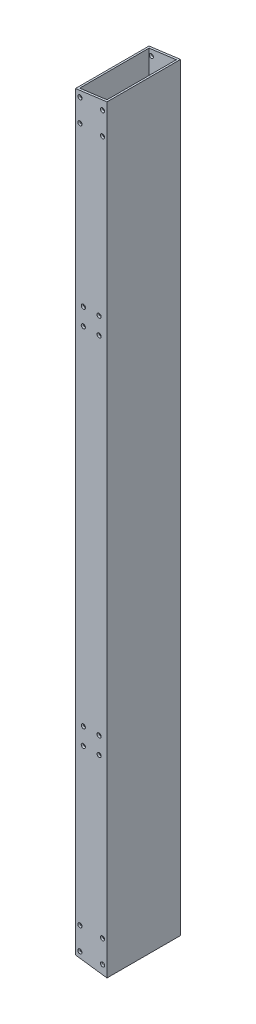
from build123d import *

# Parameters (mm, degrees)
SKETCH_1_W          = 30
SKETCH_1_H          = 750
SKETCH_1_R          = 2
EXTRUDE_2_DEPTH     = 70
SKETCH_2_W          = 26
SKETCH_2_H          = 66
CUT_EXTRUDE_3_DEPTH = 754.408919512
CUT_EXTRUDE_4_DEPTH = 382.772183376
SKETCH_8_R          = 2
CUT_EXTRUDE_6_DEPTH = 382.772183376


with BuildPart() as part:
    # 草图1 → 凸台-拉伸2 (new body)
    with BuildSketch(Plane.XY):
        Rectangle(SKETCH_1_W, SKETCH_1_H)
        with Locations((-7.5, 194.978117754)):
            Circle(SKETCH_1_R, mode=Mode.SUBTRACT)
        with Locations((7.5, 194.978117754)):
            Circle(SKETCH_1_R, mode=Mode.SUBTRACT)
        with Locations((-7.5, 178.773554479)):
            Circle(SKETCH_1_R, mode=Mode.SUBTRACT)
        with Locations((7.5, 178.773554479)):
            Circle(SKETCH_1_R, mode=Mode.SUBTRACT)
        with Locations((-7.5, -150.877478614)):
            Circle(SKETCH_1_R, mode=Mode.SUBTRACT)
        with Locations((7.5, -150.877478614)):
            Circle(SKETCH_1_R, mode=Mode.SUBTRACT)
        with Locations((-7.5, -167.08204189)):
            Circle(SKETCH_1_R, mode=Mode.SUBTRACT)
        with Locations((7.5, -167.08204189)):
            Circle(SKETCH_1_R, mode=Mode.SUBTRACT)
    extrude(amount=EXTRUDE_2_DEPTH)

    # 草图2 → 切除-拉伸3 (cut, through all)
    with BuildSketch(Plane.XZ.offset(375)):
        with Locations((0, 35)):
            Rectangle(SKETCH_2_W, SKETCH_2_H)
    extrude(amount=-CUT_EXTRUDE_3_DEPTH, mode=Mode.SUBTRACT)

    # 草图3 → 切除-拉伸4 (cut, through all)
    with BuildSketch(Plane.XY.offset(70)):
        Polygon((-15, 371.050425072), (15, 375), (15, 377.040830045), (-15, 377.040830045), align=None)
        Polygon((15, -375), (15, -347.1), (-15, -343.150425072), (-15, -375), align=None)
    extrude(amount=-CUT_EXTRUDE_4_DEPTH, mode=Mode.SUBTRACT)

    # 草图8 → 切除-拉伸6 (cut, through all)
    with BuildSketch(Plane(origin=(0, 0, 0), x_dir=(-1, 0, 0), z_dir=(0, 0, -1))):
        with Locations((-10.752728605, -316.565073143)):
            Circle(SKETCH_8_R)
        with Locations((10.752728605, -338.070530352)):
            Circle(SKETCH_8_R)
        with Locations((10.752728605, -316.565073143)):
            Circle(SKETCH_8_R)
        with Locations((-10.752728605, -338.070530352)):
            Circle(SKETCH_8_R)
        with Locations((-10.752728605, 365.970530352)):
            Circle(SKETCH_8_R)
        with Locations((-10.752728605, 344.465073143)):
            Circle(SKETCH_8_R)
        with Locations((10.752728605, 344.465073143)):
            Circle(SKETCH_8_R)
        with Locations((10.752728605, 365.970530352)):
            Circle(SKETCH_8_R)
    extrude(amount=-CUT_EXTRUDE_6_DEPTH, mode=Mode.SUBTRACT)


solid = part.part
